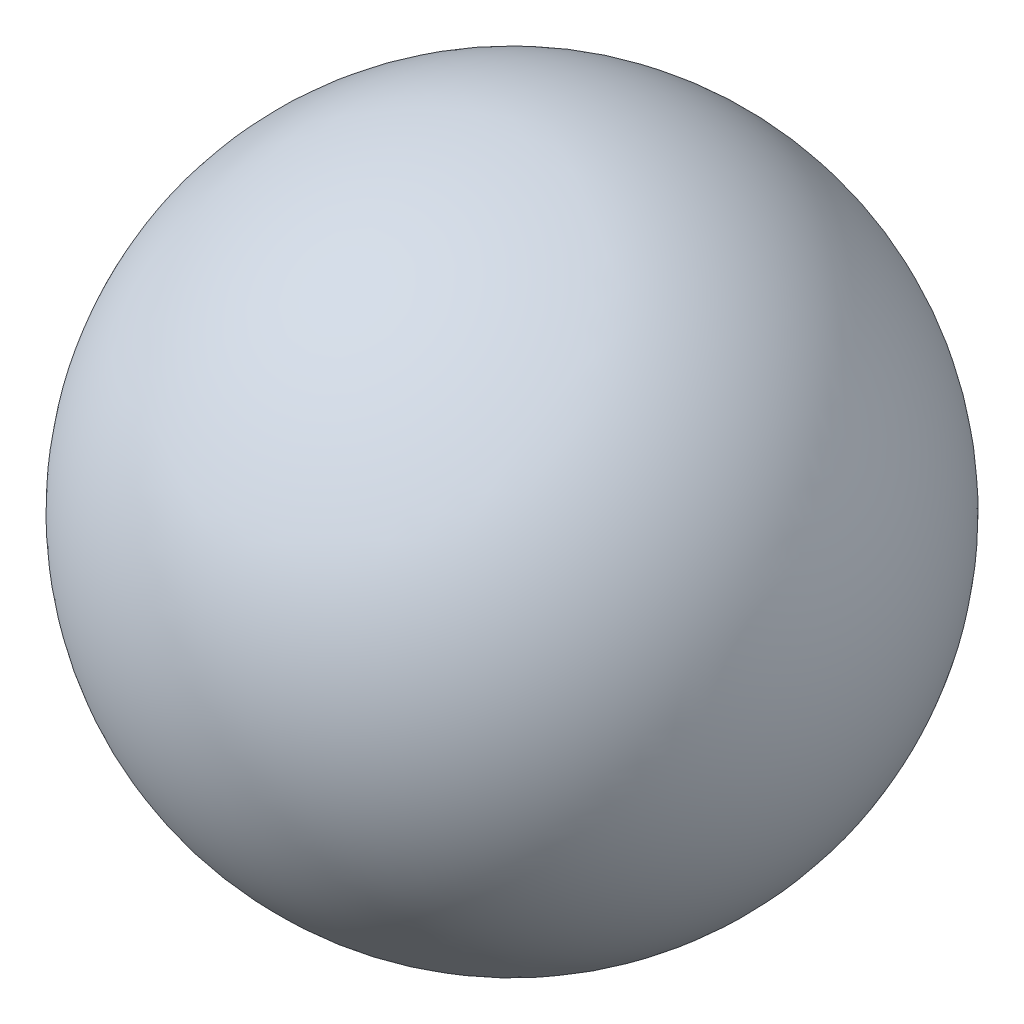
from build123d import *


with BuildPart() as part:
    # Sketch2 → Revolve1 (revolve)
    with BuildSketch(Plane(origin=(0, 0, 0), x_dir=(1, 0, 0), z_dir=(0, 1, 0))):
        with BuildLine():
            Line((-38.1, 0), (38.1, 0))
            ThreePointArc((38.1, 0), (0, 38.1), (-38.1, 0))
        make_face()
    revolve(axis=Axis((-38.1, 0, 0), (1, 0, 0)))


solid = part.part
